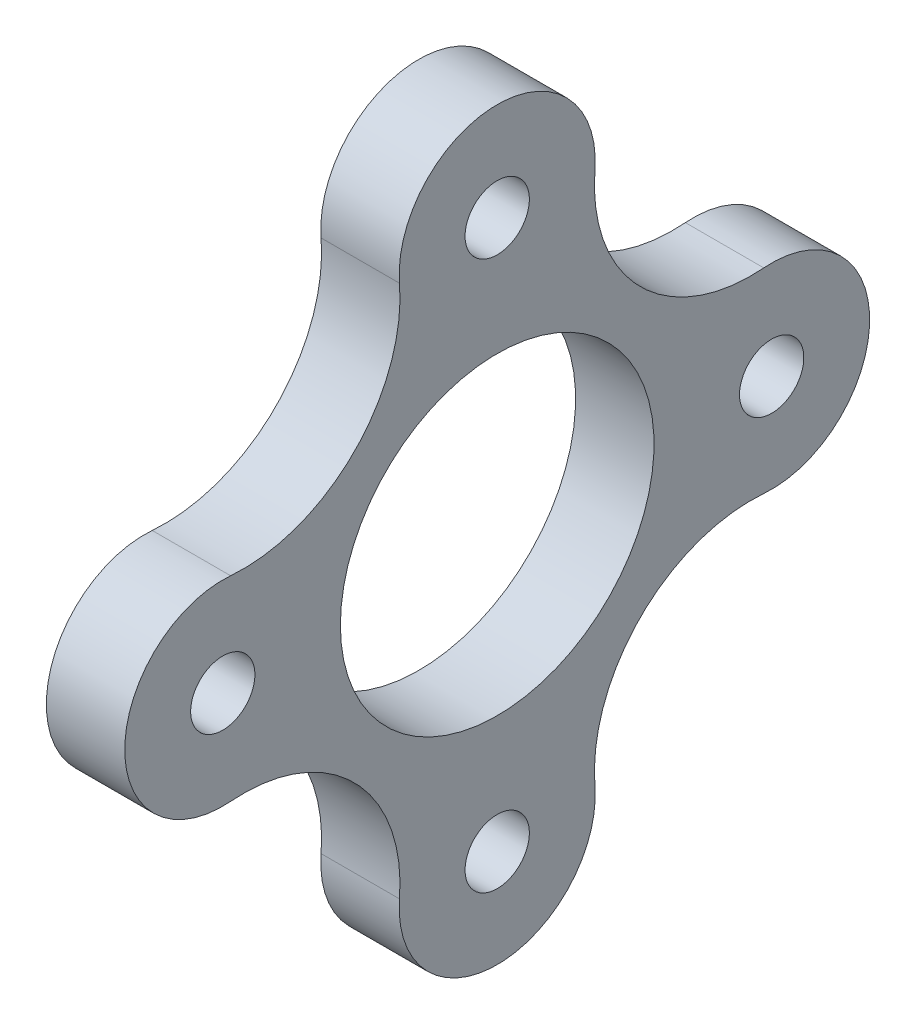
from build123d import *

# Parameters (mm, degrees)
SKETCH1_R           = 12.7
SKETCH1_R_2         = 2.6035
BOSS_EXTRUDE1_DEPTH = 6.35


with BuildPart() as part:
    # Sketch1 → Boss-Extrude1 (new body)
    with BuildSketch(Plane.ZY.offset(-33.3375)):
        with BuildLine():
            ThreePointArc((30.1625, 187.45), (27.608066517, 181.616776095), (21.588893417, 179.53802966))
            ThreePointArc((21.588893417, 179.53802966), (11.590866764, 175.859133236), (7.91197034, 165.861106583))
            ThreePointArc((7.91197034, 165.861106583), (5.833223905, 159.841933483), (0, 157.2875))
            ThreePointArc((0, 157.2875), (-5.833223905, 159.841933483), (-7.91197034, 165.861106583))
            ThreePointArc((-7.91197034, 165.861106583), (-11.590866764, 175.859133236), (-21.588893417, 179.53802966))
            ThreePointArc((-21.588893417, 179.53802966), (-27.608066517, 181.616776095), (-30.1625, 187.45))
            ThreePointArc((-30.1625, 187.45), (-27.608066517, 193.283223905), (-21.588893417, 195.36197034))
            ThreePointArc((-21.588893417, 195.36197034), (-11.590866764, 199.040866764), (-7.91197034, 209.038893417))
            ThreePointArc((-7.91197034, 209.038893417), (-5.833223905, 215.058066517), (0, 217.6125))
            ThreePointArc((0, 217.6125), (5.833223905, 215.058066517), (7.91197034, 209.038893417))
            ThreePointArc((7.91197034, 209.038893417), (11.590866764, 199.040866764), (21.588893417, 195.36197034))
            ThreePointArc((21.588893417, 195.36197034), (27.608066517, 193.283223905), (30.1625, 187.45))
        make_face()
        with Locations((0, 187.45)):
            Circle(SKETCH1_R, mode=Mode.SUBTRACT)
        with Locations((22.225, 187.45)):
            Circle(SKETCH1_R_2, mode=Mode.SUBTRACT)
        with Locations((0, 165.225)):
            Circle(SKETCH1_R_2, mode=Mode.SUBTRACT)
        with Locations((-22.225, 187.45)):
            Circle(SKETCH1_R_2, mode=Mode.SUBTRACT)
        with Locations((0, 209.675)):
            Circle(SKETCH1_R_2, mode=Mode.SUBTRACT)
    extrude(amount=BOSS_EXTRUDE1_DEPTH)


solid = part.part
